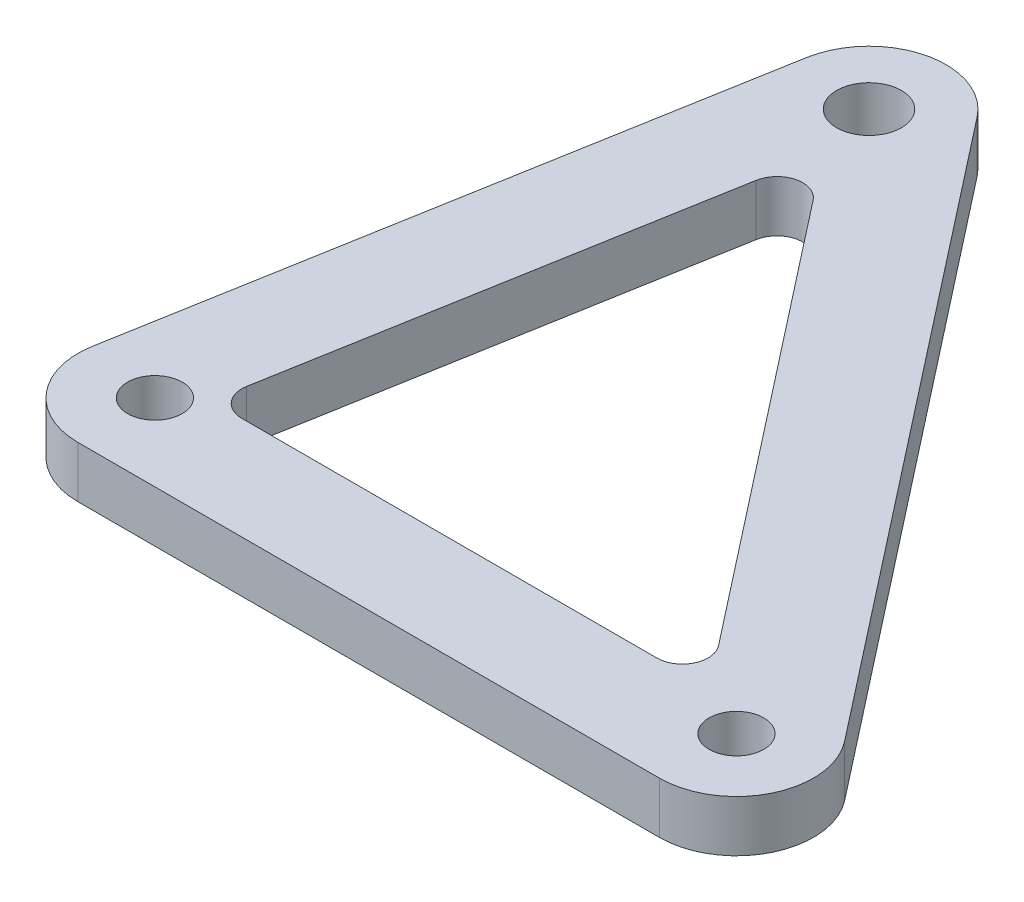
from build123d import *

# Parameters (mm, degrees)
SKETCH1_R           = 4
SKETCH1_R_2         = 3.3782
BOSS_EXTRUDE2_DEPTH = 6.35


with BuildPart() as part:
    # Sketch1 → Boss-Extrude2 (new body)
    with BuildSketch(Plane(origin=(0, 0, 0), x_dir=(1, 0, 0), z_dir=(0, 1, 0))):
        with BuildLine():
            Line((79.386405256, 5.865963413), (20.726765648, 80.910011751))
            ThreePointArc((20.726765648, 80.910011751), (10.916360949, 84.285692708), (3.84185454, 76.696844221))
            Line((3.84185454, 76.696844221), (-9.380506141, 1.652794466))
            ThreePointArc((-9.380506141, 1.652794466), (-7.296180243, -6.123020403), (0, -9.525))
            Line((0, -9.525), (71.882, -9.525))
            ThreePointArc((71.882, -9.525), (80.443510571, -4.174465444), (79.386405256, 5.865963413))
        make_face()
        with BuildLine():
            Line((58.858632611, 3.175), (7.566649209, 3.175))
            ThreePointArc((7.566649209, 3.175), (5.134589064, 4.308993275), (4.439813863, 6.900931684))
            Line((4.439813863, 6.900931684), (13.874736256, 60.449220264))
            ThreePointArc((13.874736256, 60.449220264), (16.232904863, 62.978836655), (19.503039878, 61.853609899))
            Line((19.503039878, 61.853609899), (61.360100888, 8.305321319))
            ThreePointArc((61.360100888, 8.305321319), (61.712469519, 4.958511622), (58.858632611, 3.175))
        make_face(mode=Mode.SUBTRACT)
        with Locations((13.222360424, 75.044048297)):
            Circle(SKETCH1_R, mode=Mode.SUBTRACT)
        with Locations((71.882, 0)):
            Circle(SKETCH1_R_2, mode=Mode.SUBTRACT)
        Circle(SKETCH1_R_2, mode=Mode.SUBTRACT)
    extrude(amount=BOSS_EXTRUDE2_DEPTH)


solid = part.part
